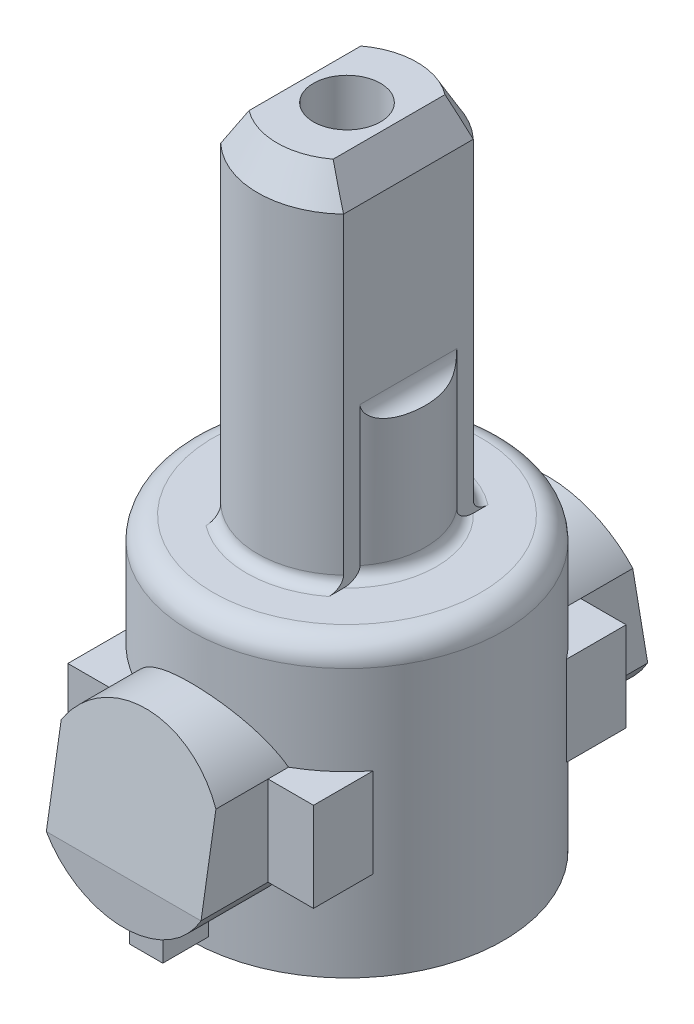
from build123d import *
from OCP.BRepFilletAPI import BRepFilletAPI_MakeChamfer

# Parameters (mm, degrees)
EXTRUDE1_DEPTH      = 3.5
EXTRUDE1_DEPTH_BACK = 3
SKETCH1_R           = 3.5
SKETCH2_W           = 5.5
SKETCH2_H           = 1.334936491
EXTRUDE2_DEPTH      = 1
EXTRUDE3_DEPTH      = 5
EXTRUDE4_DEPTH      = 8.03562381
SKETCH5_W           = 1.25
SKETCH5_H           = 1
EXTRUDE7_DEPTH      = 0.375
EXTRUDE8_DEPTH      = 8
CHAMFER1_SIZE       = 0.75
CHAMFER1_SIZE2      = 0.433012702
SKETCH7_R           = 0.75
EXTRUDE9_DEPTH      = 2
SKETCH8_R           = 1.75
EXTRUDE10_DEPTH     = 3
FILLET1_R           = 0.375
FILLET2_R           = 0.25
FILLET3_R           = 0.5
SKETCH9_R           = 3
EXTRUDE11_DEPTH     = 6
FILLET4_R           = 0.25
SKETCH10_R          = 1
EXTRUDE12_DEPTH     = 7
EXTRUDE13_REACH     = 17.732
CHAMFER2_SIZE       = 0.35


with BuildPart() as part:
    # Sketch1 → Extrude1 (new, two sides: drawn at the far end of the back side and taken through both)
    with BuildSketch(Plane(origin=(0, 0, 0), x_dir=(1, 0, 0), z_dir=(0, 1, 0)).offset(-EXTRUDE1_DEPTH_BACK)):
        with Locations(Location((0, 0, 0), (0, 0, 270))):
            Circle(SKETCH1_R)
    extrude(amount=EXTRUDE1_DEPTH + EXTRUDE1_DEPTH_BACK)

    # Sketch2 → Extrude2 (add, symmetric)
    with BuildSketch(Plane(origin=(0, 0, 0), x_dir=(1, 0, 0), z_dir=(0, 1, 0))):
        with Locations((0, 2.832531755)):
            Rectangle(SKETCH2_W, SKETCH2_H)
        with Locations((0, -2.832531755)):
            Rectangle(SKETCH2_W, SKETCH2_H)
    extrude(amount=EXTRUDE2_DEPTH, both=True)

    # Sketch3 → Extrude3 (add, symmetric)
    with BuildSketch(Plane.XY):
        with BuildLine():
            Line((1.732050808, 1), (1.732050808, -1))
            ThreePointArc((1.732050808, -1), (0, -2), (-1.732050808, -1))
            Line((-1.732050808, -1), (-1.732050808, 1))
            ThreePointArc((-1.732050808, 1), (0, 2), (1.732050808, 1))
        make_face()
    extrude(amount=EXTRUDE3_DEPTH, both=True)

    # Sketch4 → Extrude4 (cut, symmetric)
    with BuildSketch(Plane(origin=(0, 0, 0), x_dir=(0, 0, -1), z_dir=(1, 0, 0))):
        Polygon((-10.249541192, -32.497247152), (-5, -1), (-4.5, 2), (0.749541192, 33.497247152), (-62.244953112, 43.996329536), (-73.244035496, -21.998164768), align=None)
    extrude4 = extrude(amount=EXTRUDE4_DEPTH, both=True, mode=Mode.SUBTRACT)

    # Mirror1: Extrude4 across plane
    add(extrude4.mirror(Plane.XY), mode=Mode.SUBTRACT)

    # Sketch5 → Extrude7 (add, symmetric)
    with BuildSketch(Plane(origin=(0, 0, 0), x_dir=(0, 0, -1), z_dir=(1, 0, 0))):
        with Locations((-3.875, -2.25)):
            Rectangle(SKETCH5_W, SKETCH5_H)
        with Locations((3.875, -2.25)):
            Rectangle(SKETCH5_W, SKETCH5_H)
    extrude(amount=EXTRUDE7_DEPTH, both=True)

    # Sketch6 → Extrude8 (add)
    with BuildSketch(Plane(origin=(0, 3.5, 0), x_dir=(1, 0, 0), z_dir=(0, 1, 0))):
        with BuildLine():
            Line((1.375, 1.452368755), (1.375, -1.452368755))
            ThreePointArc((1.375, -1.452368755), (0, -2), (-1.375, -1.452368755))
            Line((-1.375, -1.452368755), (-1.375, 1.452368755))
            ThreePointArc((-1.375, 1.452368755), (0, 2), (1.375, 1.452368755))
        make_face()
    extrude(amount=EXTRUDE8_DEPTH)

    # Chamfer1: one chamfer whose edges measure the first distance from different faces: ONE call of the kernel's chamfer builder (chamfer() names one face for all edges)
    chamfer1_edges_1 = [part.edges().sort_by_distance(p)[0] for p in [
        (0, 11.5, -2),
    ]]
    chamfer1_side_1 = [part.faces().sort_by_distance(p)[0] for p in [
        (0, 7.5, -2),
    ]]
    chamfer1_edges_2 = [part.edges().sort_by_distance(p)[0] for p in [
        (-1.375, 11.5, 0),
    ]]
    chamfer1_side_2 = [part.faces().sort_by_distance(p)[0] for p in [
        (-1.375, 7.5, 0),
    ]]
    chamfer1_edges_3 = [part.edges().sort_by_distance(p)[0] for p in [
        (0, 11.5, 2),
    ]]
    chamfer1_side_3 = [part.faces().sort_by_distance(p)[0] for p in [
        (0, 7.5, 2),
    ]]
    chamfer1_edges_4 = [part.edges().sort_by_distance(p)[0] for p in [
        (1.375, 11.5, 0),
    ]]
    chamfer1_side_4 = [part.faces().sort_by_distance(p)[0] for p in [
        (1.375, 7.5, 0),
    ]]
    chamfer1 = BRepFilletAPI_MakeChamfer(part.part.solid().wrapped)
    for e in chamfer1_edges_1:
        chamfer1.Add(CHAMFER1_SIZE, CHAMFER1_SIZE2, e.wrapped, chamfer1_side_1[0].wrapped)  # the first distance lies on this face
    for e in chamfer1_edges_2:
        chamfer1.Add(CHAMFER1_SIZE, CHAMFER1_SIZE2, e.wrapped, chamfer1_side_2[0].wrapped)  # the first distance lies on this face
    for e in chamfer1_edges_3:
        chamfer1.Add(CHAMFER1_SIZE, CHAMFER1_SIZE2, e.wrapped, chamfer1_side_3[0].wrapped)  # the first distance lies on this face
    for e in chamfer1_edges_4:
        chamfer1.Add(CHAMFER1_SIZE, CHAMFER1_SIZE2, e.wrapped, chamfer1_side_4[0].wrapped)  # the first distance lies on this face
    add(Compound.cast(chamfer1.Shape()), mode=Mode.REPLACE)

    # Sketch7 → Extrude9 (cut)
    with BuildSketch(Plane(origin=(0, 11.5, 0), x_dir=(1, 0, 0), z_dir=(0, 1, 0))):
        with Locations(Location((0, 0, 0), (0, 0, 270))):
            Circle(SKETCH7_R)
    extrude(amount=-EXTRUDE9_DEPTH, mode=Mode.SUBTRACT)

    # Sketch8 → Extrude10 (add)
    with BuildSketch(Plane(origin=(0, 3.5, 0), x_dir=(1, 0, 0), z_dir=(0, 1, 0))):
        Circle(SKETCH8_R)
    extrude(amount=EXTRUDE10_DEPTH)

    # Fillet1
    fillet1_edges = [part.edges().sort_by_distance(p)[0] for p in [
        (1.375, 6.5, 0),
        (-1.375, 6.5, 0),
    ]]
    fillet(fillet1_edges, radius=FILLET1_R - 0.0001)  # a hair under: the kernel refuses the full size

    # Fillet2
    fillet2_edges = [part.edges().sort_by_distance(p)[0] for p in [
        (-1.75, 3.5, 0),
        (0, 3.5, -2),
        (1.75, 3.5, 0),
        (0, 3.5, 2),
    ]]
    fillet(fillet2_edges, radius=FILLET2_R - 0.0001)  # a hair under: the kernel refuses the full size

    # Fillet3
    fillet3_edges = [part.edges().sort_by_distance(p)[0] for p in [
        (0, 3.5, -3.5),
    ]]
    fillet(fillet3_edges, radius=FILLET3_R)

    # Sketch9 → Extrude11 (cut)
    with BuildSketch(Plane.XZ.offset(3)):
        with Locations(Location((0, 0, 0), (0, 0, 270))):
            Circle(SKETCH9_R)
    extrude(amount=-EXTRUDE11_DEPTH, mode=Mode.SUBTRACT)

    # Fillet4
    fillet4_edges = [part.edges().sort_by_distance(p)[0] for p in [
        (0, 3, 3),
    ]]
    fillet(fillet4_edges, radius=FILLET4_R)

    # Sketch10 → Extrude12 (add)
    with BuildSketch(Plane.XZ.offset(-3)):
        with Locations(Location((0, 0, 0), (0, 0, 90))):
            Circle(SKETCH10_R)
    extrude(amount=EXTRUDE12_DEPTH)

    # Sketch11 → Extrude13 (add, up to next)
    with BuildSketch(Plane.XZ.offset(3), mode=Mode.PRIVATE) as extrude13_sk1:
        with BuildLine():
            Line((2.989565186, 0.25), (2.625, 0.25))
            Line((2.625, 0.25), (2.625, -0.25))
            Line((2.625, -0.25), (2.989565186, -0.25))
            ThreePointArc((2.989565186, -0.25), (3, 0), (2.989565186, 0.25))
        make_face()
    extrude13_tool1 = extrude(extrude13_sk1.sketch, amount=-EXTRUDE13_REACH, mode=Mode.PRIVATE) - part.part
    # Sketch11 → Extrude13 (add, up to next)
    with BuildSketch(Plane.XZ.offset(3), mode=Mode.PRIVATE) as extrude13_sk2:
        with BuildLine():
            Line((-2.625, 0.25), (-2.625, -0.25))
            Line((-2.625, -0.25), (-2.989565186, -0.25))
            ThreePointArc((-2.989565186, -0.25), (-3, 0), (-2.989565186, 0.25))
            Line((-2.989565186, 0.25), (-2.625, 0.25))
        make_face()
    extrude13_tool2 = extrude(extrude13_sk2.sketch, amount=-EXTRUDE13_REACH, mode=Mode.PRIVATE) - part.part
    add(extrude13_tool1.solids().sort_by_distance((2.810775, -3, 0))[0])
    add(extrude13_tool2.solids().sort_by_distance((-2.810775, -3, 0))[0])

    # Chamfer2
    chamfer2_edges = [part.edges().sort_by_distance(p)[0] for p in [
        (2.625, -3, 0),
        (-2.625, -3, 0),
    ]]
    chamfer(chamfer2_edges, length=CHAMFER2_SIZE)


solid = part.part
